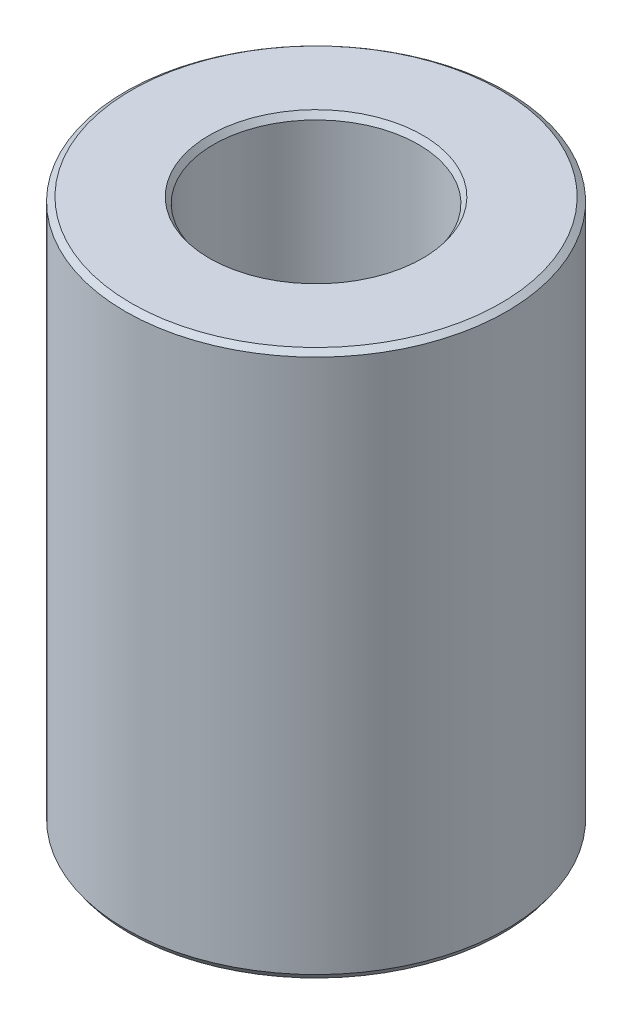
from build123d import *
from OCP.BRepFilletAPI import BRepFilletAPI_MakeChamfer

# Parameters (mm, degrees)
SKETCH1_R           = 25
BOSS_EXTRUDE1_DEPTH = 71.466312188
SKETCH2_R           = 13.440169531
CUT_EXTRUDE1_DEPTH  = 80.733517279
CHAMFER1_SIZE       = 0.550454017
CHAMFER1_SIZE2      = 0.779476207


with BuildPart() as part:
    # Sketch1 → Boss-Extrude1 (new body)
    with BuildSketch(Plane(origin=(0, 0, 0), x_dir=(1, 0, 0), z_dir=(0, 1, 0))):
        Circle(SKETCH1_R)
    extrude(amount=BOSS_EXTRUDE1_DEPTH)

    # Sketch2 → Cut-Extrude1 (cut, through all)
    with BuildSketch(Plane(origin=(0, 0, 0), x_dir=(1, 0, 0), z_dir=(0, 1, 0))):
        Circle(SKETCH2_R)
    extrude(amount=CUT_EXTRUDE1_DEPTH, mode=Mode.SUBTRACT)

    # Chamfer1: one chamfer whose edges measure the first distance from different faces: ONE call of the kernel's chamfer builder (chamfer() names one face for all edges)
    chamfer1_edges_1 = [part.edges().sort_by_distance(p)[0] for p in [
        (-13.440169531, 71.466312188, 0),
    ]]
    chamfer1_side_1 = [part.faces().sort_by_distance(p)[0] for p in [
        (-24.292893219, 71.466312188, 0),
    ]]
    chamfer1_edges_2 = [part.edges().sort_by_distance(p)[0] for p in [
        (-13.440169531, 0, 0),
    ]]
    chamfer1_side_2 = [part.faces().sort_by_distance(p)[0] for p in [
        (-13.440169531, 35.733156094, 0),
    ]]
    chamfer1_edges_3 = [part.edges().sort_by_distance(p)[0] for p in [
        (-25, 0, 0),
    ]]
    chamfer1_side_3 = [part.faces().sort_by_distance(p)[0] for p in [
        (-24.292893219, 0, 0),
    ]]
    chamfer1_edges_4 = [part.edges().sort_by_distance(p)[0] for p in [
        (-25, 71.466312188, 0),
    ]]
    chamfer1_side_4 = [part.faces().sort_by_distance(p)[0] for p in [
        (-25, 35.733156094, 0),
    ]]
    chamfer1 = BRepFilletAPI_MakeChamfer(part.part.solid().wrapped)
    for e in chamfer1_edges_1:
        chamfer1.Add(CHAMFER1_SIZE, CHAMFER1_SIZE2, e.wrapped, chamfer1_side_1[0].wrapped)  # the first distance lies on this face
    for e in chamfer1_edges_2:
        chamfer1.Add(CHAMFER1_SIZE, CHAMFER1_SIZE2, e.wrapped, chamfer1_side_2[0].wrapped)  # the first distance lies on this face
    for e in chamfer1_edges_3:
        chamfer1.Add(CHAMFER1_SIZE, CHAMFER1_SIZE2, e.wrapped, chamfer1_side_3[0].wrapped)  # the first distance lies on this face
    for e in chamfer1_edges_4:
        chamfer1.Add(CHAMFER1_SIZE, CHAMFER1_SIZE2, e.wrapped, chamfer1_side_4[0].wrapped)  # the first distance lies on this face
    add(Compound.cast(chamfer1.Shape()), mode=Mode.REPLACE)


solid = part.part
